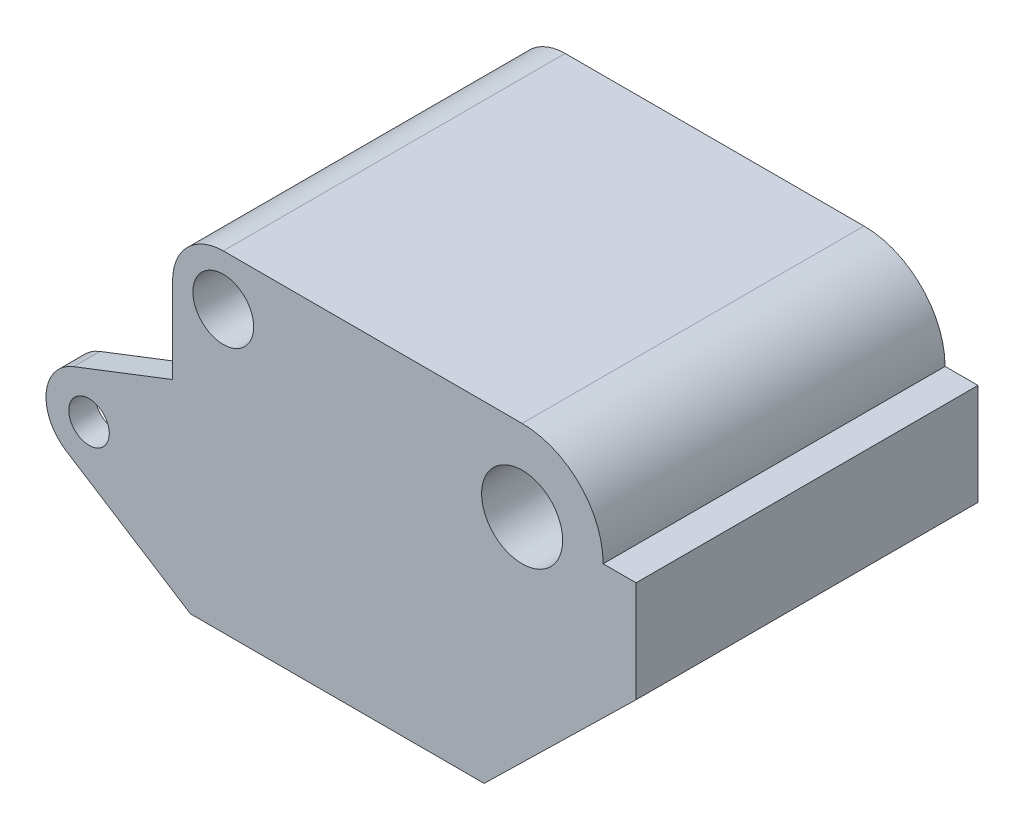
from build123d import *

# Parameters (mm, degrees)
SKETCH_2_R               = 4
SKETCH_2_R_2             = 2
SKETCH_2_R_3             = 2.5
SKETCH_2_R_4             = 1.5
SKETCH_2_R_5             = 2.125
SKETCH_2_R_6             = 1
EXTRUDE_1_DEPTH          = 17.125
CUT_EXTRUDE_1_DEPTH      = 137.144257132
CUT_EXTRUDE_1_DEPTH_BACK = 137.144257132
SKETCH_3_W               = 6.985996156
SKETCH_3_H               = 14.275
CUT_EXTRUDE_START        = -128.325
CUT_EXTRUDE_2_OUTLINE_W  = 32
CUT_EXTRUDE_2_OUTLINE_H  = 0.125
CUT_EXTRUDE_2_DEPTH      = 16.325


# Read off the part's stored shape, not the designer's step: 切除-拉伸2
with BuildPart() as part:
    # 草图2 → 凸台-拉伸1 (new body)
    # profile 1 of 4: a face of its own
    with BuildSketch(Plane.XY.offset(8.375)):
        with BuildLine():
            Line((-15.5, -121), (-15.5, -116))
            Line((-15.5, -116), (-17.125, -116))
            ThreePointArc((-17.125, -116), (-23.953427125, -118.828427125), (-21.125, -112))
            Line((-21.125, -112), (-35.875, -112))
            ThreePointArc((-35.875, -112), (-34.107233047, -112.732233047), (-33.375, -114.5))
            ThreePointArc((-33.375, -114.5), (-35.875, -117), (-38.375, -114.5))
            Line((-38.375, -114.5), (-38.375, -118.75))
            Line((-38.375, -118.75), (-43.26696162, -120.643234405))
            ThreePointArc((-43.26696162, -120.643234405), (-41.298785706, -120.872085507), (-40.375, -122.625))
            ThreePointArc((-40.375, -122.625), (-41.477365663, -124.487751731), (-43.640735541, -124.417860124))
            Line((-43.640735541, -124.417860124), (-37.5, -128.325))
            Line((-37.5, -128.325), (-23, -128.325))
            Line((-23, -128.325), (-15.5, -121))
        make_face()
    # profile 2 of 4: a face of its own
    with BuildSketch(Plane.XY.offset(8.375)):
        with Locations((-21.125, -116)):
            Circle(SKETCH_2_R)
        with Locations((-21.125, -116)):
            Circle(SKETCH_2_R_2, mode=Mode.SUBTRACT)
    # profile 3 of 4: a face of its own
    with BuildSketch(Plane.XY.offset(8.375)):
        with Locations((-35.875, -114.5)):
            Circle(SKETCH_2_R_3)
        with Locations((-35.875, -114.5)):
            Circle(SKETCH_2_R_4, mode=Mode.SUBTRACT)
    # profile 4 of 4: a face of its own
    with BuildSketch(Plane.XY.offset(8.375)):
        with Locations((-42.5, -122.625)):
            Circle(SKETCH_2_R_5)
        with Locations((-42.5, -122.625)):
            Circle(SKETCH_2_R_6, mode=Mode.SUBTRACT)
    extrude(amount=-EXTRUDE_1_DEPTH)

    # 草图3 → 切除-拉伸1 (cut, two sides: drawn at the far end of the back side and taken through both)
    with BuildSketch(Plane(origin=(0, 0, 0), x_dir=(1, 0, 0), z_dir=(0, 1, 0)).offset(-CUT_EXTRUDE_1_DEPTH_BACK)):
        with Locations((-42.942998078, 0.1875)):
            Rectangle(SKETCH_3_W, SKETCH_3_H)
    extrude(amount=CUT_EXTRUDE_1_DEPTH + CUT_EXTRUDE_1_DEPTH_BACK, mode=Mode.SUBTRACT)

    # 切除-拉伸2 outline → 切除-拉伸2 (cut)
    with BuildSketch(Plane(origin=(0, 0, 0), x_dir=(1, 0, 0), z_dir=(0, 1, 0)).offset(CUT_EXTRUDE_START)):
        with Locations((-30, -8.3125)):
            Rectangle(CUT_EXTRUDE_2_OUTLINE_W, CUT_EXTRUDE_2_OUTLINE_H)
        with Locations((-30, 8.6875)):
            Rectangle(CUT_EXTRUDE_2_OUTLINE_W, CUT_EXTRUDE_2_OUTLINE_H)
    extrude(amount=CUT_EXTRUDE_2_DEPTH, mode=Mode.SUBTRACT)


solid = part.part
